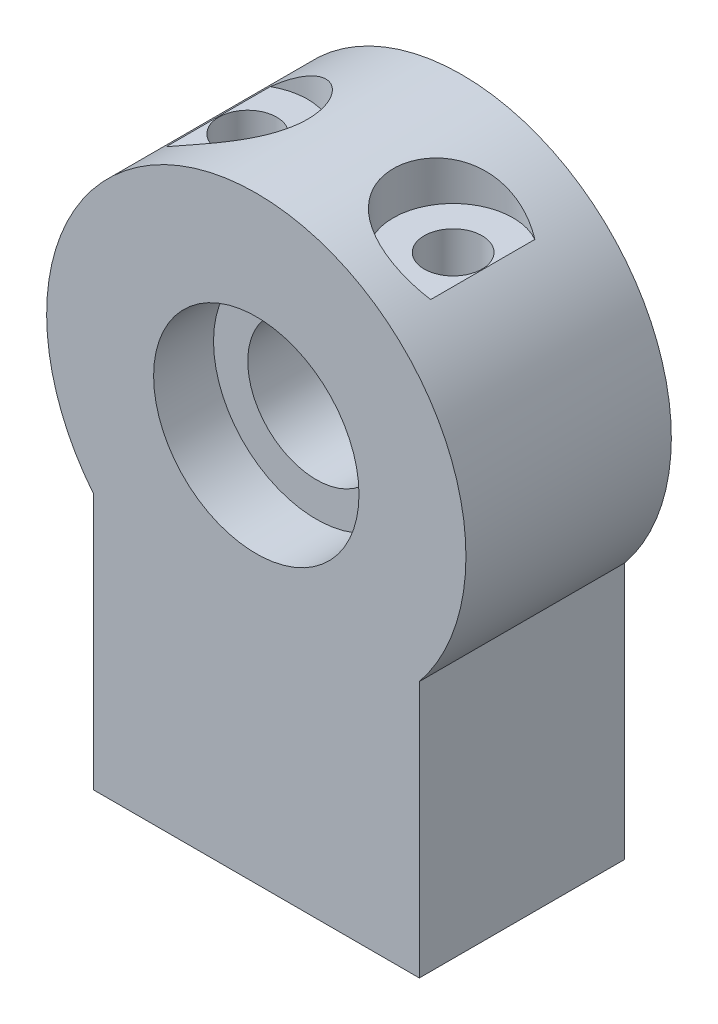
from build123d import *

# Parameters (mm, degrees)
SKETCH1_R               = 12
BOSS_EXTRUDE1_DEPTH     = 7
BOSS_EXTRUDE2_START     = -17
SKETCH2_R               = 8
BOSS_EXTRUDE2_DEPTH     = 17
CUT_EXTRUDE1_DEPTH      = 55.315950696
CUT_EXTRUDE1_DEPTH_BACK = 55.315950696
SKETCH3_R               = 3.38
CUT_EXTRUDE2_START      = 36
SKETCH4_R               = 7
CUT_EXTRUDE2_DEPTH      = 17


with BuildPart() as part:
    # Sketch1 → Boss-Extrude1 (new body)
    with BuildSketch(Plane.XY):
        with BuildLine():
            Line((-19.05, -45.4), (19.05, -45.4))
            Line((19.05, -45.4), (19.05, -15.4))
            ThreePointArc((19.05, -15.4), (0, 24.496173171), (-19.05, -15.4))
            Line((-19.05, -15.4), (-19.05, -45.4))
        make_face()
        Circle(SKETCH1_R, mode=Mode.SUBTRACT)
    extrude(amount=BOSS_EXTRUDE1_DEPTH)

    # Sketch2 → Boss-Extrude2 (add)
    with BuildSketch(Plane.XY.offset(BOSS_EXTRUDE2_START)):
        with BuildLine():
            Line((-19.05, -45.4), (19.05, -45.4))
            Line((19.05, -45.4), (19.05, -15.4))
            ThreePointArc((19.05, -15.4), (0, 24.496173171), (-19.05, -15.4))
            Line((-19.05, -15.4), (-19.05, -45.4))
        make_face()
        Circle(SKETCH2_R, mode=Mode.SUBTRACT)
    extrude(amount=BOSS_EXTRUDE2_DEPTH)

    # Sketch3 → Cut-Extrude1 (cut, two sides: drawn at the far end of the back side and taken through both)
    with BuildSketch(Plane(origin=(0, 0, 0), x_dir=(1, 0, 0), z_dir=(0, 1, 0)).offset(-CUT_EXTRUDE1_DEPTH_BACK)):
        with Locations((-12, 4)):
            Circle(SKETCH3_R)
        with Locations((12, 4)):
            Circle(SKETCH3_R)
    extrude(amount=CUT_EXTRUDE1_DEPTH + CUT_EXTRUDE1_DEPTH_BACK, mode=Mode.SUBTRACT)

    # Sketch4 → Cut-Extrude2 (cut)
    with BuildSketch(Plane(origin=(0, 0, 0), x_dir=(1, 0, 0), z_dir=(0, 1, 0)).offset(CUT_EXTRUDE2_START)):
        with Locations((-12, 4)):
            Circle(SKETCH4_R)
        with Locations((12, 4)):
            Circle(SKETCH4_R)
    extrude(amount=-CUT_EXTRUDE2_DEPTH, mode=Mode.SUBTRACT)


solid = part.part
